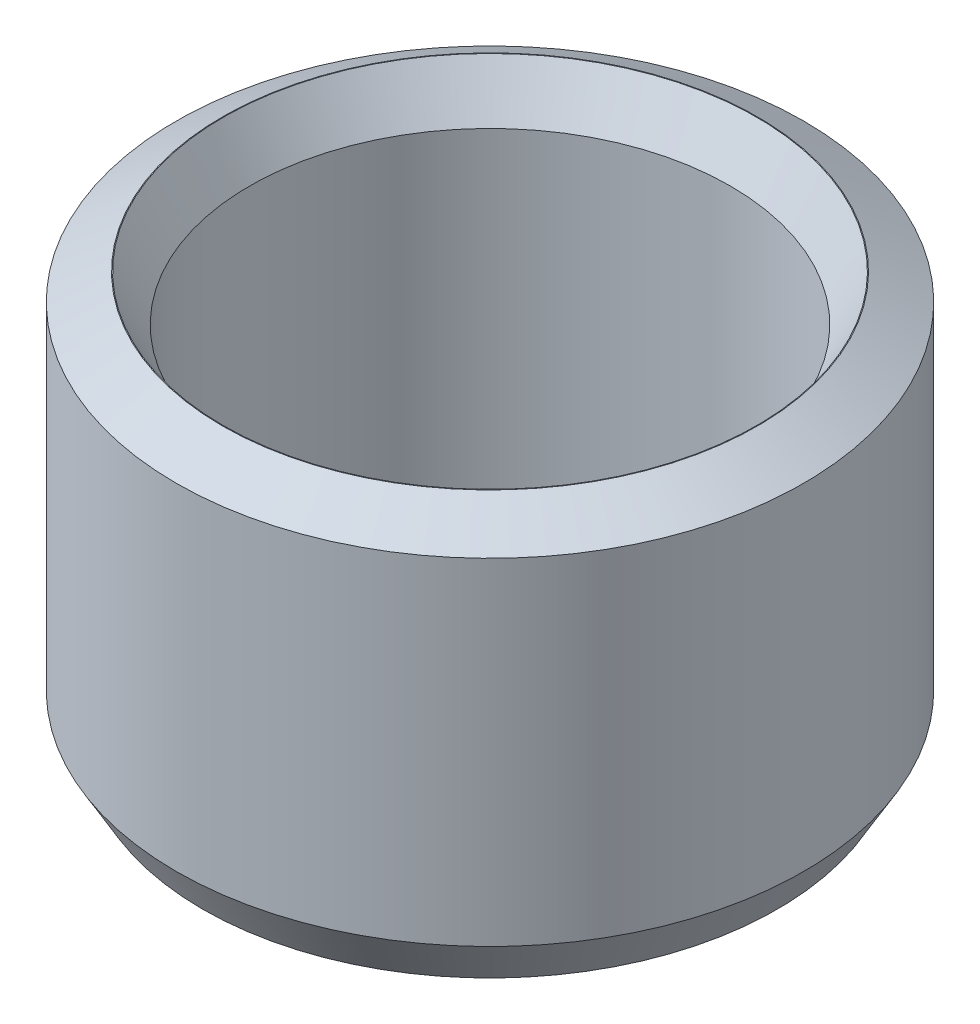
from build123d import *
from OCP.BRepFilletAPI import BRepFilletAPI_MakeChamfer

# Parameters (mm, degrees)
SKETCH1_R           = 35
BOSS_EXTRUDE1_DEPTH = 45.614966505
SKETCH2_R           = 26.804862028
CUT_EXTRUDE1_DEPTH  = 68.310661631
CHAMFER1_SIZE       = 2.96884233
CHAMFER1_SIZE2      = 5.142185756


with BuildPart() as part:
    # Sketch1 → Boss-Extrude1 (new body)
    with BuildSketch(Plane(origin=(0, 0, 0), x_dir=(1, 0, 0), z_dir=(0, 1, 0))):
        Circle(SKETCH1_R)
    extrude(amount=BOSS_EXTRUDE1_DEPTH)

    # Sketch2 → Cut-Extrude1 (cut, through all)
    with BuildSketch(Plane(origin=(0, 0, 0), x_dir=(1, 0, 0), z_dir=(0, 1, 0))):
        Circle(SKETCH2_R)
    extrude(amount=CUT_EXTRUDE1_DEPTH, mode=Mode.SUBTRACT)

    # Chamfer1: one chamfer whose edges measure the first distance from different faces: ONE call of the kernel's chamfer builder (chamfer() names one face for all edges)
    chamfer1_edges_1 = [part.edges().sort_by_distance(p)[0] for p in [
        (-26.804862028, 45.614966505, 0),
    ]]
    chamfer1_side_1 = [part.faces().sort_by_distance(p)[0] for p in [
        (-34.010050506, 45.614966505, 0),
    ]]
    chamfer1_edges_2 = [part.edges().sort_by_distance(p)[0] for p in [
        (-26.804862028, 0, 0),
    ]]
    chamfer1_side_2 = [part.faces().sort_by_distance(p)[0] for p in [
        (-26.804862028, 22.807483252, 0),
    ]]
    chamfer1_edges_3 = [part.edges().sort_by_distance(p)[0] for p in [
        (-35, 0, 0),
    ]]
    chamfer1_side_3 = [part.faces().sort_by_distance(p)[0] for p in [
        (-34.010050506, 0, 0),
    ]]
    chamfer1_edges_4 = [part.edges().sort_by_distance(p)[0] for p in [
        (-35, 45.614966505, 0),
    ]]
    chamfer1_side_4 = [part.faces().sort_by_distance(p)[0] for p in [
        (-35, 22.807483252, 0),
    ]]
    chamfer1 = BRepFilletAPI_MakeChamfer(part.part.solid().wrapped)
    for e in chamfer1_edges_1:
        chamfer1.Add(CHAMFER1_SIZE, CHAMFER1_SIZE2, e.wrapped, chamfer1_side_1[0].wrapped)  # the first distance lies on this face
    for e in chamfer1_edges_2:
        chamfer1.Add(CHAMFER1_SIZE, CHAMFER1_SIZE2, e.wrapped, chamfer1_side_2[0].wrapped)  # the first distance lies on this face
    for e in chamfer1_edges_3:
        chamfer1.Add(CHAMFER1_SIZE, CHAMFER1_SIZE2, e.wrapped, chamfer1_side_3[0].wrapped)  # the first distance lies on this face
    for e in chamfer1_edges_4:
        chamfer1.Add(CHAMFER1_SIZE, CHAMFER1_SIZE2, e.wrapped, chamfer1_side_4[0].wrapped)  # the first distance lies on this face
    add(Compound.cast(chamfer1.Shape()), mode=Mode.REPLACE)


solid = part.part
